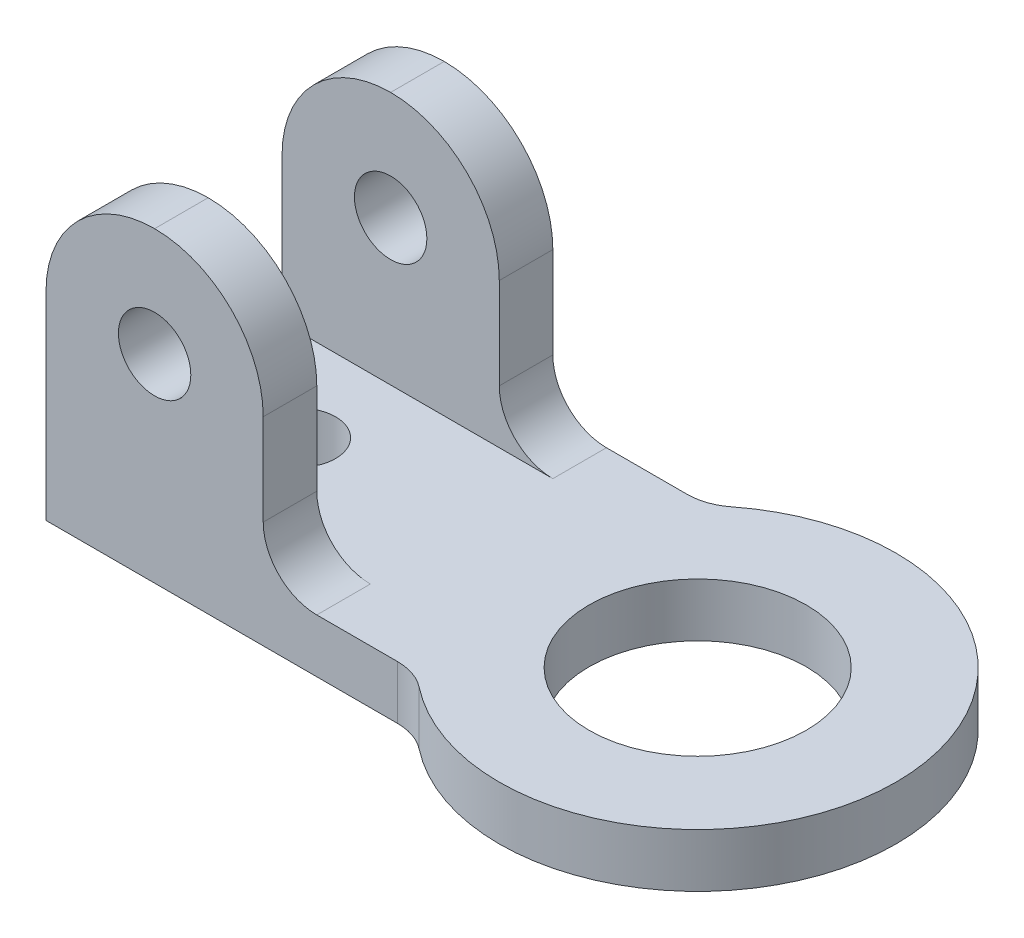
from build123d import *

# Parameters (mm, degrees)
SKETCH1_R           = 19.05
SKETCH1_R_2         = 6.35
BOSS_EXTRUDE1_DEPTH = 9.398
SKETCH4_W           = 38.1
SKETCH4_H           = 9.398
BOSS_EXTRUDE3_DEPTH = 44.45
FILLET1_R           = 19.05
FILLET2_R           = 9.398
CUT_EXTRUDE1_REACH  = 122.111
SKETCH6_R           = 6.35


with BuildPart() as part:
    # Sketch1 → Boss-Extrude1 (new body)
    with BuildSketch(Plane(origin=(0, 0, 0), x_dir=(1, 0, 0), z_dir=(0, 1, 0))):
        with BuildLine():
            Line((-23.785306473, 25.4), (-88.9, 25.4))
            Line((-88.9, 25.4), (-88.9, -25.4))
            Line((-88.9, -25.4), (-23.785306473, -25.4))
            ThreePointArc((-23.785306473, -25.4), (34.798, 0), (-23.785306473, 25.4))
        make_face()
        with Locations(Location((0, 0, 0), (0, 0, 270))):
            Circle(SKETCH1_R, mode=Mode.SUBTRACT)
        with Locations(Location((-69.85, 0, 0), (0, 0, 270))):
            Circle(SKETCH1_R_2, mode=Mode.SUBTRACT)
    extrude(amount=BOSS_EXTRUDE1_DEPTH)

    # Sketch4 → Boss-Extrude3 (add)
    with BuildSketch(Plane(origin=(0, 9.398, 0), x_dir=(1, 0, 0), z_dir=(0, 1, 0))):
        with Locations((-69.85, 20.701)):
            Rectangle(SKETCH4_W, SKETCH4_H)
        with Locations((-69.85, -20.701)):
            Rectangle(SKETCH4_W, SKETCH4_H)
    extrude(amount=BOSS_EXTRUDE3_DEPTH)

    # Fillet1
    fillet1_edges = [part.edges().sort_by_distance(p)[0] for p in [
        (-88.9, 53.848, 20.701),
        (-88.9, 53.848, -20.701),
        (-50.8, 53.848, -20.701),
        (-50.8, 53.848, 20.701),
    ]]
    fillet(fillet1_edges, radius=FILLET1_R - 0.0001)  # a hair under: the kernel refuses the full size

    # Fillet2
    fillet2_edges = [part.edges().sort_by_distance(p)[0] for p in [
        (-23.785306473, 4.699, 25.4),
        (-23.785306473, 4.699, -25.4),
        (-50.8, 9.398, -20.701),
        (-50.8, 9.398, 20.701),
    ]]
    fillet(fillet2_edges, radius=FILLET2_R)

    # Cut-Extrude1: up to this face of the body (flat: up to its plane)
    cut_extrude1_end = Plane(part.part.faces().sort_by_distance((-66.468021602, 22.831221423, -25.4))[0])
    # Sketch6 → Cut-Extrude1 (cut, up to the picked face)
    with BuildSketch(Plane.XY.offset(25.4), mode=Mode.PRIVATE) as cut_extrude1_sk1:
        with Locations((-69.85, 34.798)):
            Circle(SKETCH6_R)
    cut_extrude1_tool1 = split(extrude(cut_extrude1_sk1.sketch, amount=-CUT_EXTRUDE1_REACH, mode=Mode.PRIVATE), bisect_by=cut_extrude1_end, keep=Keep.BOTH, mode=Mode.PRIVATE)
    add(cut_extrude1_tool1.solids().sort_by(Axis((-69.85, 34.798, 25.4), (0, 0, -1)))[0], mode=Mode.SUBTRACT)


solid = part.part
